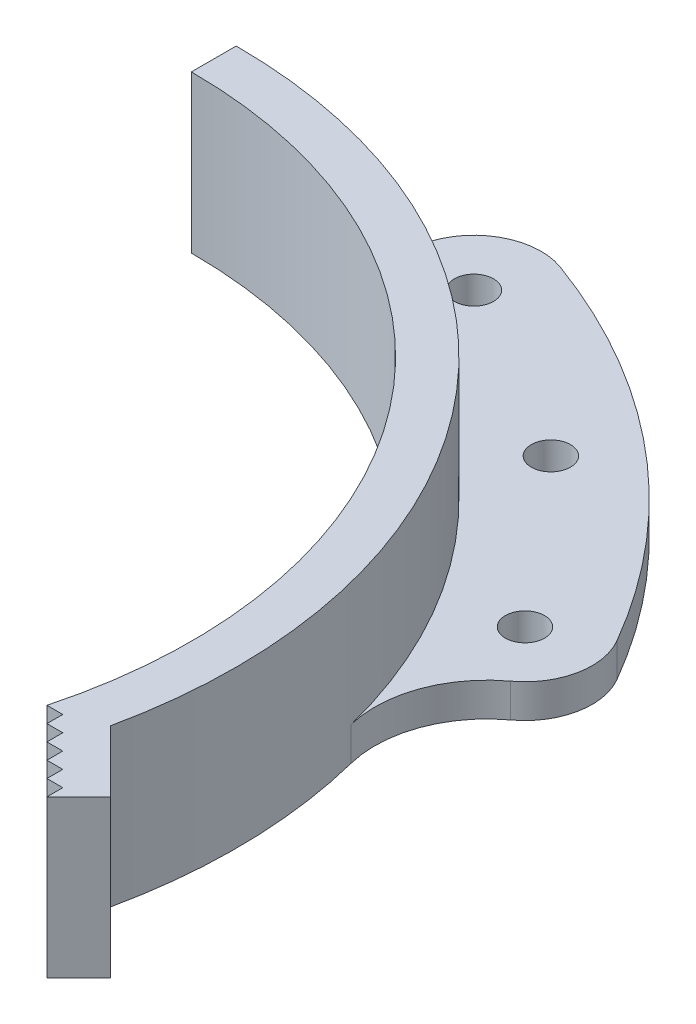
from build123d import *

# Parameters (mm, degrees)
SKETCH_1_R              = 1.75
EXTRUDE_1_DEPTH         = 3
EXTRUDE_2511_DEPTH      = 11
EXTRUDE_2511_DEPTH_BACK = 3
FILLET1_R               = 10


with BuildPart() as part:
    # Эскиз1 → Бобышка-Вытянуть1 (new body)
    with BuildSketch(Plane(origin=(0, 0, 0), x_dir=(1, 0, 0), z_dir=(0, 1, 0))):
        with BuildLine():
            Line((0, 48), (0, 52))
            ThreePointArc((0, 52), (6.283445482, 51.618972412), (12.474807654, 50.481473572))
            ThreePointArc((12.474807654, 50.481473572), (14.921144436, 55.582006519), (20.5212086, 56.381557247))
            ThreePointArc((20.5212086, 56.381557247), (38.567256581, 45.962666587), (51.961524227, 30))
            ThreePointArc((51.961524227, 30), (49.765371804, 21.803847577), (41.569219382, 24))
            ThreePointArc((41.569219382, 24), (24, 41.569219382), (0, 48))
        make_face()
        with Locations((34.710530923, 41.366399928)):
            Circle(SKETCH_1_R, mode=Mode.SUBTRACT)
        with Locations((18.46908774, 50.743401522)):
            Circle(SKETCH_1_R, mode=Mode.SUBTRACT)
        with Locations((46.765371804, 27)):
            Circle(SKETCH_1_R, mode=Mode.SUBTRACT)
    extrude(amount=EXTRUDE_1_DEPTH)

    # Эскиз2 → Extrude 2511 (add, two sides: drawn at the far end of the back side and taken through both)
    with BuildSketch(Plane(origin=(0, 3, 0), x_dir=(1, 0, 0), z_dir=(0, 1, 0)).offset(-EXTRUDE_2511_DEPTH_BACK)):
        with BuildLine():
            Line((49.571804169, -18.459105796), (49.571804169, -17.044892234))
            Line((49.571804169, -17.044892234), (48.157590606, -17.044892234))
            Line((48.157590606, -17.044892234), (48.157590606, -15.630678672))
            Line((48.157590606, -15.630678672), (46.743377044, -15.630678672))
            Line((46.743377044, -15.630678672), (46.743377044, -14.216465109))
            Line((46.743377044, -14.216465109), (45.329163481, -14.216465109))
            Line((45.329163481, -14.216465109), (45.329163481, -12.802251547))
            Line((45.329163481, -12.802251547), (43.914949919, -12.802251547))
            Line((43.914949919, -12.802251547), (43.914949919, -11.388037985))
            Line((43.914949919, -11.388037985), (42.500736357, -11.388037985))
            ThreePointArc((42.500736357, -11.388037985), (34.907546973, 26.785502876), (0, 44))
            Line((0, 44), (0, 48))
            ThreePointArc((0, 48), (37.356415971, 30.141303651), (46.915461546, -10.145908925))
            Line((46.915461546, -10.145908925), (52.400231293, -15.630678672))
            Line((52.400231293, -15.630678672), (49.571804169, -18.459105796))
        make_face()
    extrude(amount=EXTRUDE_2511_DEPTH + EXTRUDE_2511_DEPTH_BACK)

    # Fillet1
    fillet1_edges = [part.edges().sort_by_distance(p)[0] for p in [
        (41.569219382, 1.5, -24),
    ]]
    fillet(fillet1_edges, radius=FILLET1_R)


solid = part.part
